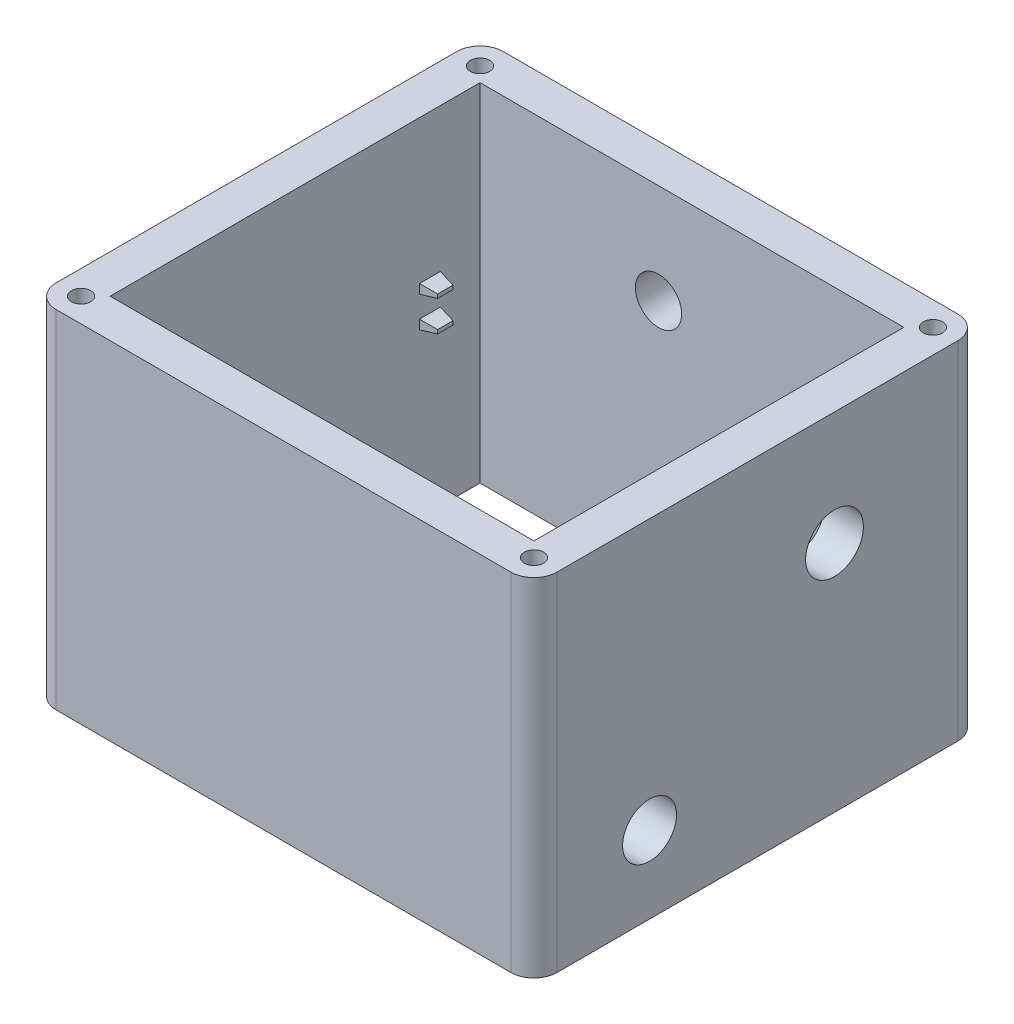
from build123d import *

# Parameters (mm, degrees)
BASE_SKETCH_W                   = 65
BASE_SKETCH_H                   = 58
BASE_SKETCH_W_2                 = 55
BASE_SKETCH_H_2                 = 48
WALLS_DEPTH                     = 45
CLIPS_START                     = 25
SKETCH_8_W                      = 2
SKETCH_8_H                      = 3
SKETCH_8_W_2                    = 3
SKETCH_8_H_2                    = 2
CLIPS_TOP_DEPTH                 = 1.5
CLIPS_START_2                   = 21
SKETCH_10_W                     = 2
SKETCH_10_H                     = 3
SKETCH_10_W_2                   = 3
SKETCH_10_H_2                   = 2
CLIPS_BOTTOM_DEPTH              = 1.5
CHAMFER5_SIZE                   = 2.83564091
CHAMFER5_SIZE_2                 = 0.5
CHAMFER6_SIZE                   = 2.83564091
CHAMFER6_SIZE_2                 = 0.5
CHAMFER4_SIZE                   = 2.83564091
CHAMFER4_SIZE_2                 = 0.5
CHAMFER7_SIZE                   = 2.83564091
CHAMFER7_SIZE_2                 = 0.5
CHAMFER8_SIZE                   = 2.83564091
CHAMFER8_SIZE_2                 = 0.5
CHAMFER9_SIZE                   = 2.83564091
CHAMFER9_SIZE_2                 = 0.5
RIGHT_START                     = 70
JACK_ENCODER_R                  = 3.5
JACK_ENCODER_R_2                = 3.75
RIGHT_HOLES_DEPTH               = 23
FILLET1_R                       = 3
HOLES_R                         = 1.25
MOUNTING_HOLES_DEPTH            = 99.051007134
ON_OFF_START                    = -50
ON_OFF_SWITCH_R                 = 3
ON_OFF_TOGGLE_SWITCH_HOLE_DEPTH = 13
BOSS_EXTRUDE7_START             = -58
ON_OFF_SWITCH_7_R               = 0.8
BOSS_EXTRUDE7_DEPTH             = 0.9


with BuildPart() as part:
    # Base Sketch → Walls (new body)
    with BuildSketch(Plane(origin=(0, 0, 0), x_dir=(1, 0, 0), z_dir=(0, 1, 0))):
        with Locations((32.5, 29)):
            Rectangle(BASE_SKETCH_W, BASE_SKETCH_H)
        with Locations((32.5, 29)):
            Rectangle(BASE_SKETCH_W_2, BASE_SKETCH_H_2, mode=Mode.SUBTRACT)
    extrude(amount=WALLS_DEPTH)

    # Sketch<8> → Clips Top (add)
    with BuildSketch(Plane(origin=(0, 0, 0), x_dir=(1, 0, 0), z_dir=(0, 1, 0)).offset(CLIPS_START)):
        with Locations((6, 46.5)):
            Rectangle(SKETCH_8_W, SKETCH_8_H)
        with Locations((59, 31.5)):
            Rectangle(SKETCH_8_W, SKETCH_8_H)
        with Locations((45.5, 6)):
            Rectangle(SKETCH_8_W_2, SKETCH_8_H_2)
    extrude(amount=CLIPS_TOP_DEPTH)

    # Sketch<10> → Clips Bottom (add)
    with BuildSketch(Plane(origin=(0, 0, 0), x_dir=(1, 0, 0), z_dir=(0, 1, 0)).offset(CLIPS_START_2)):
        with Locations((6, 46.5)):
            Rectangle(SKETCH_10_W, SKETCH_10_H)
        with Locations((59, 31.5)):
            Rectangle(SKETCH_10_W, SKETCH_10_H)
        with Locations((45.5, 6)):
            Rectangle(SKETCH_10_W_2, SKETCH_10_H_2)
    extrude(amount=CLIPS_BOTTOM_DEPTH)

    # Chamfer5
    # the kernel refuses this chamfer: 2.83564091, 0.5 mm, written as the material it takes off along each edge
    with BuildSketch(Plane(origin=(58, 17.631477083, -33), x_dir=(0.9999776716360547, 0, -0.006682531656102045), z_dir=(0, 1, 0))) as chamfer5_piece_1_section:
        Polygon((CHAMFER5_SIZE * 0.999977671569, -CHAMFER5_SIZE * 0.00668253165565), (-CHAMFER5_SIZE_2 * 0.0066825316561, -CHAMFER5_SIZE_2 * 0.999977671636), (0, 0), align=None)
    chamfer5_piece_1 = extrude(amount=16.237045834, mode=Mode.PRIVATE)
    chamfer5_piece_1 = split(chamfer5_piece_1, bisect_by=Plane(origin=(60, 25.75, -32.822153916), z_dir=(-1, 0, 0)), keep=Keep.TOP, mode=Mode.PRIVATE)
    chamfer5_piece_1 = split(chamfer5_piece_1, bisect_by=Plane(origin=(58.818410381, 22.5, -32.822153916), z_dir=(0, 1, 0)), keep=Keep.TOP, mode=Mode.PRIVATE)
    add(chamfer5_piece_1, mode=Mode.SUBTRACT)
    with BuildSketch(Plane(origin=(58, 26.5, -40.368522917), x_dir=(0.9999776716360547, 0.006682531656102045, -2.368422901677664e-15), z_dir=(0, 0, 1))) as chamfer5_piece_2_section:
        Polygon((CHAMFER5_SIZE * 0.999977671569, -CHAMFER5_SIZE * 0.00668253165565), (-CHAMFER5_SIZE_2 * 0.0066825316561, -CHAMFER5_SIZE_2 * 0.999977671636), (0, 0), align=None)
    chamfer5_piece_2 = extrude(amount=17.737045834, mode=Mode.PRIVATE)
    chamfer5_piece_2 = split(chamfer5_piece_2, bisect_by=Plane(origin=(60, 26.322153916, -31.5), z_dir=(-1, 0, 0)), keep=Keep.TOP, mode=Mode.PRIVATE)
    add(chamfer5_piece_2, mode=Mode.SUBTRACT)
    with BuildSketch(Plane(origin=(58, 17.631477083, -30), x_dir=(0.9999776716360547, 0, 0.006682531656103251), z_dir=(0, 1, 0))) as chamfer5_piece_3_section:
        Polygon((CHAMFER5_SIZE * 0.999977671569, CHAMFER5_SIZE * 0.00668253165565), (-CHAMFER5_SIZE_2 * 0.0066825316561, CHAMFER5_SIZE_2 * 0.999977671636), (0, 0), align=None)
    chamfer5_piece_3 = extrude(amount=16.237045834, mode=Mode.PRIVATE)
    chamfer5_piece_3 = split(chamfer5_piece_3, bisect_by=Plane(origin=(60, 25.75, -30.177846084), z_dir=(-1, 0, 0)), keep=Keep.TOP, mode=Mode.PRIVATE)
    chamfer5_piece_3 = split(chamfer5_piece_3, bisect_by=Plane(origin=(58.818410381, 22.5, -30.177846084), z_dir=(0, 1, 0)), keep=Keep.TOP, mode=Mode.PRIVATE)
    add(chamfer5_piece_3, mode=Mode.SUBTRACT)
    with BuildSketch(Plane(origin=(58, 25, -40.368522917), x_dir=(0.9999776716360547, -0.006682531656102045, -2.368422901677664e-15), z_dir=(0, 0, 1))) as chamfer5_piece_4_section:
        Polygon((CHAMFER5_SIZE * 0.999977671569, CHAMFER5_SIZE * 0.00668253165565), (-CHAMFER5_SIZE_2 * 0.0066825316561, CHAMFER5_SIZE_2 * 0.999977671636), (0, 0), align=None)
    chamfer5_piece_4 = extrude(amount=17.737045834, mode=Mode.PRIVATE)
    chamfer5_piece_4 = split(chamfer5_piece_4, bisect_by=Plane(origin=(60, 25.177846084, -31.5), z_dir=(-1, 0, 0)), keep=Keep.TOP, mode=Mode.PRIVATE)
    add(chamfer5_piece_4, mode=Mode.SUBTRACT)

    # Chamfer6
    # the kernel refuses this chamfer: 2.83564091, 0.5 mm, written as the material it takes off along each edge
    with BuildSketch(Plane(origin=(47, 17.631477083, -7), x_dir=(0.0066825316561019464, 0, 0.9999776716360547), z_dir=(0, 1, 0))) as chamfer6_piece_1_section:
        Polygon((CHAMFER6_SIZE * 0.999977671569, -CHAMFER6_SIZE * 0.00668253165565), (-CHAMFER6_SIZE_2 * 0.0066825316561, -CHAMFER6_SIZE_2 * 0.999977671636), (0, 0), align=None)
    chamfer6_piece_1 = extrude(amount=16.237045834, mode=Mode.PRIVATE)
    chamfer6_piece_1 = split(chamfer6_piece_1, bisect_by=Plane(origin=(46.822153916, 25.75, -5), z_dir=(0, 0, -1)), keep=Keep.TOP, mode=Mode.PRIVATE)
    chamfer6_piece_1 = split(chamfer6_piece_1, bisect_by=Plane(origin=(46.822153916, 22.5, -6.181589619), z_dir=(0, 1, 0)), keep=Keep.TOP, mode=Mode.PRIVATE)
    add(chamfer6_piece_1, mode=Mode.SUBTRACT)
    with BuildSketch(Plane(origin=(54.368522917, 26.5, -7), x_dir=(0, 0.0066825316561019464, 0.9999776716360547), z_dir=(-1, 0, 0))) as chamfer6_piece_2_section:
        Polygon((CHAMFER6_SIZE * 0.999977671569, -CHAMFER6_SIZE * 0.00668253165565), (-CHAMFER6_SIZE_2 * 0.0066825316561, -CHAMFER6_SIZE_2 * 0.999977671636), (0, 0), align=None)
    chamfer6_piece_2 = extrude(amount=17.737045834, mode=Mode.PRIVATE)
    chamfer6_piece_2 = split(chamfer6_piece_2, bisect_by=Plane(origin=(45.5, 26.322153916, -5), z_dir=(0, 0, -1)), keep=Keep.TOP, mode=Mode.PRIVATE)
    add(chamfer6_piece_2, mode=Mode.SUBTRACT)
    with BuildSketch(Plane(origin=(44, 17.631477083, -7), x_dir=(-0.0066825316561019464, 0, 0.9999776716360547), z_dir=(0, 1, 0))) as chamfer6_piece_3_section:
        Polygon((CHAMFER6_SIZE * 0.999977671569, CHAMFER6_SIZE * 0.00668253165565), (-CHAMFER6_SIZE_2 * 0.0066825316561, CHAMFER6_SIZE_2 * 0.999977671636), (0, 0), align=None)
    chamfer6_piece_3 = extrude(amount=16.237045834, mode=Mode.PRIVATE)
    chamfer6_piece_3 = split(chamfer6_piece_3, bisect_by=Plane(origin=(44.177846084, 25.75, -5), z_dir=(0, 0, -1)), keep=Keep.TOP, mode=Mode.PRIVATE)
    chamfer6_piece_3 = split(chamfer6_piece_3, bisect_by=Plane(origin=(44.177846084, 22.5, -6.181589619), z_dir=(0, 1, 0)), keep=Keep.TOP, mode=Mode.PRIVATE)
    add(chamfer6_piece_3, mode=Mode.SUBTRACT)
    with BuildSketch(Plane(origin=(54.368522917, 25, -7), x_dir=(0, -0.0066825316561019464, 0.9999776716360547), z_dir=(-1, 0, 0))) as chamfer6_piece_4_section:
        Polygon((CHAMFER6_SIZE * 0.999977671569, CHAMFER6_SIZE * 0.00668253165565), (-CHAMFER6_SIZE_2 * 0.0066825316561, CHAMFER6_SIZE_2 * 0.999977671636), (0, 0), align=None)
    chamfer6_piece_4 = extrude(amount=17.737045834, mode=Mode.PRIVATE)
    chamfer6_piece_4 = split(chamfer6_piece_4, bisect_by=Plane(origin=(45.5, 25.177846084, -5), z_dir=(0, 0, -1)), keep=Keep.TOP, mode=Mode.PRIVATE)
    add(chamfer6_piece_4, mode=Mode.SUBTRACT)

    # Chamfer4
    # the kernel refuses this chamfer: 2.83564091, 0.5 mm, written as the material it takes off along each edge
    with BuildSketch(Plane(origin=(7, 17.631477083, -45), x_dir=(-0.9999776716360547, 0, 0.006682531656101981), z_dir=(0, 1, 0))) as chamfer4_piece_1_section:
        Polygon((CHAMFER4_SIZE * 0.999977671569, -CHAMFER4_SIZE * 0.00668253165565), (-CHAMFER4_SIZE_2 * 0.0066825316561, -CHAMFER4_SIZE_2 * 0.999977671636), (0, 0), align=None)
    chamfer4_piece_1 = extrude(amount=16.237045834, mode=Mode.PRIVATE)
    chamfer4_piece_1 = split(chamfer4_piece_1, bisect_by=Plane(origin=(5, 25.75, -45.177846084), z_dir=(1, 0, 0)), keep=Keep.TOP, mode=Mode.PRIVATE)
    chamfer4_piece_1 = split(chamfer4_piece_1, bisect_by=Plane(origin=(6.181589619, 22.5, -45.177846084), z_dir=(0, 1, 0)), keep=Keep.TOP, mode=Mode.PRIVATE)
    add(chamfer4_piece_1, mode=Mode.SUBTRACT)
    with BuildSketch(Plane(origin=(7, 26.5, -37.631477083), x_dir=(-0.9999776716360547, 0.006682531656101981, 0), z_dir=(0, 0, -1))) as chamfer4_piece_2_section:
        Polygon((CHAMFER4_SIZE * 0.999977671569, -CHAMFER4_SIZE * 0.00668253165565), (-CHAMFER4_SIZE_2 * 0.0066825316561, -CHAMFER4_SIZE_2 * 0.999977671636), (0, 0), align=None)
    chamfer4_piece_2 = extrude(amount=10.368522917, mode=Mode.PRIVATE)
    chamfer4_piece_2 = split(chamfer4_piece_2, bisect_by=Plane(origin=(5, 26.322153916, -46.5), z_dir=(1, 0, 0)), keep=Keep.TOP, mode=Mode.PRIVATE)
    add(chamfer4_piece_2, mode=Mode.SUBTRACT)
    with BuildSketch(Plane(origin=(7, 17.631477083, -48), x_dir=(-0.9999776716360547, 0, -0.006682531656101981), z_dir=(0, 1, 0))) as chamfer4_piece_3_section:
        Polygon((CHAMFER4_SIZE * 0.999977671569, CHAMFER4_SIZE * 0.00668253165565), (-CHAMFER4_SIZE_2 * 0.0066825316561, CHAMFER4_SIZE_2 * 0.999977671636), (0, 0), align=None)
    chamfer4_piece_3 = extrude(amount=16.237045834, mode=Mode.PRIVATE)
    chamfer4_piece_3 = split(chamfer4_piece_3, bisect_by=Plane(origin=(5, 25.75, -47.822153916), z_dir=(1, 0, 0)), keep=Keep.TOP, mode=Mode.PRIVATE)
    chamfer4_piece_3 = split(chamfer4_piece_3, bisect_by=Plane(origin=(6.181589619, 22.5, -47.822153916), z_dir=(0, 1, 0)), keep=Keep.TOP, mode=Mode.PRIVATE)
    add(chamfer4_piece_3, mode=Mode.SUBTRACT)
    with BuildSketch(Plane(origin=(7, 25, -37.631477083), x_dir=(-0.9999776716360547, -0.006682531656101981, 0), z_dir=(0, 0, -1))) as chamfer4_piece_4_section:
        Polygon((CHAMFER4_SIZE * 0.999977671569, CHAMFER4_SIZE * 0.00668253165565), (-CHAMFER4_SIZE_2 * 0.0066825316561, CHAMFER4_SIZE_2 * 0.999977671636), (0, 0), align=None)
    chamfer4_piece_4 = extrude(amount=10.368522917, mode=Mode.PRIVATE)
    chamfer4_piece_4 = split(chamfer4_piece_4, bisect_by=Plane(origin=(5, 25.177846084, -46.5), z_dir=(1, 0, 0)), keep=Keep.TOP, mode=Mode.PRIVATE)
    add(chamfer4_piece_4, mode=Mode.SUBTRACT)

    # Chamfer7
    # the kernel refuses this chamfer: 2.83564091, 0.5 mm, written as the material it takes off along each edge
    with BuildSketch(Plane(origin=(7, 13.631477083, -45), x_dir=(-0.9999776716360547, 0, 0.006682531656101981), z_dir=(0, 1, 0))) as chamfer7_piece_1_section:
        Polygon((CHAMFER7_SIZE * 0.999977671569, -CHAMFER7_SIZE * 0.00668253165565), (-CHAMFER7_SIZE_2 * 0.0066825316561, -CHAMFER7_SIZE_2 * 0.999977671636), (0, 0), align=None)
    chamfer7_piece_1 = extrude(amount=16.237045834, mode=Mode.PRIVATE)
    chamfer7_piece_1 = split(chamfer7_piece_1, bisect_by=Plane(origin=(5, 21.75, -45.177846084), z_dir=(1, 0, 0)), keep=Keep.TOP, mode=Mode.PRIVATE)
    add(chamfer7_piece_1, mode=Mode.SUBTRACT)
    with BuildSketch(Plane(origin=(7, 22.5, -37.631477083), x_dir=(-0.9999776716360547, 0.006682531656101981, 0), z_dir=(0, 0, -1))) as chamfer7_piece_2_section:
        Polygon((CHAMFER7_SIZE * 0.999977671569, -CHAMFER7_SIZE * 0.00668253165565), (-CHAMFER7_SIZE_2 * 0.0066825316561, -CHAMFER7_SIZE_2 * 0.999977671636), (0, 0), align=None)
    chamfer7_piece_2 = extrude(amount=10.368522917, mode=Mode.PRIVATE)
    chamfer7_piece_2 = split(chamfer7_piece_2, bisect_by=Plane(origin=(5, 22.322153916, -46.5), z_dir=(1, 0, 0)), keep=Keep.TOP, mode=Mode.PRIVATE)
    add(chamfer7_piece_2, mode=Mode.SUBTRACT)
    with BuildSketch(Plane(origin=(7, 13.631477083, -48), x_dir=(-0.9999776716360547, 0, -0.006682531656101981), z_dir=(0, 1, 0))) as chamfer7_piece_3_section:
        Polygon((CHAMFER7_SIZE * 0.999977671569, CHAMFER7_SIZE * 0.00668253165565), (-CHAMFER7_SIZE_2 * 0.0066825316561, CHAMFER7_SIZE_2 * 0.999977671636), (0, 0), align=None)
    chamfer7_piece_3 = extrude(amount=16.237045834, mode=Mode.PRIVATE)
    chamfer7_piece_3 = split(chamfer7_piece_3, bisect_by=Plane(origin=(5, 21.75, -47.822153916), z_dir=(1, 0, 0)), keep=Keep.TOP, mode=Mode.PRIVATE)
    add(chamfer7_piece_3, mode=Mode.SUBTRACT)
    with BuildSketch(Plane(origin=(7, 21, -37.631477083), x_dir=(-0.9999776716360547, -0.006682531656101981, 0), z_dir=(0, 0, -1))) as chamfer7_piece_4_section:
        Polygon((CHAMFER7_SIZE * 0.999977671569, CHAMFER7_SIZE * 0.00668253165565), (-CHAMFER7_SIZE_2 * 0.0066825316561, CHAMFER7_SIZE_2 * 0.999977671636), (0, 0), align=None)
    chamfer7_piece_4 = extrude(amount=10.368522917, mode=Mode.PRIVATE)
    chamfer7_piece_4 = split(chamfer7_piece_4, bisect_by=Plane(origin=(5, 21.177846084, -46.5), z_dir=(1, 0, 0)), keep=Keep.TOP, mode=Mode.PRIVATE)
    add(chamfer7_piece_4, mode=Mode.SUBTRACT)

    # Chamfer8
    # the kernel refuses this chamfer: 2.83564091, 0.5 mm, written as the material it takes off along each edge
    with BuildSketch(Plane(origin=(58, 13.631477083, -33), x_dir=(0.9999776716360547, 0, -0.006682531656102045), z_dir=(0, 1, 0))) as chamfer8_piece_1_section:
        Polygon((CHAMFER8_SIZE * 0.999977671569, -CHAMFER8_SIZE * 0.00668253165565), (-CHAMFER8_SIZE_2 * 0.0066825316561, -CHAMFER8_SIZE_2 * 0.999977671636), (0, 0), align=None)
    chamfer8_piece_1 = extrude(amount=16.237045834, mode=Mode.PRIVATE)
    chamfer8_piece_1 = split(chamfer8_piece_1, bisect_by=Plane(origin=(60, 21.75, -32.844885748), z_dir=(-1, 0, 0)), keep=Keep.TOP, mode=Mode.PRIVATE)
    add(chamfer8_piece_1, mode=Mode.SUBTRACT)
    with BuildSketch(Plane(origin=(58, 22.5, -40.368522917), x_dir=(0.9999776716360547, 0.006682531656102045, 0), z_dir=(0, 0, 1))) as chamfer8_piece_2_section:
        Polygon((CHAMFER8_SIZE * 0.999977671569, -CHAMFER8_SIZE * 0.00668253165565), (-CHAMFER8_SIZE_2 * 0.0066825316561, -CHAMFER8_SIZE_2 * 0.999977671636), (0, 0), align=None)
    chamfer8_piece_2 = extrude(amount=17.737045834, mode=Mode.PRIVATE)
    chamfer8_piece_2 = split(chamfer8_piece_2, bisect_by=Plane(origin=(60, 22.344885748, -31.5), z_dir=(-1, 0, 0)), keep=Keep.TOP, mode=Mode.PRIVATE)
    add(chamfer8_piece_2, mode=Mode.SUBTRACT)
    with BuildSketch(Plane(origin=(58, 13.631477083, -30), x_dir=(0.9999776716360547, 0, 0.006682531656103251), z_dir=(0, 1, 0))) as chamfer8_piece_3_section:
        Polygon((CHAMFER8_SIZE * 0.999977671569, CHAMFER8_SIZE * 0.00668253165565), (-CHAMFER8_SIZE_2 * 0.0066825316561, CHAMFER8_SIZE_2 * 0.999977671636), (0, 0), align=None)
    chamfer8_piece_3 = extrude(amount=16.237045834, mode=Mode.PRIVATE)
    chamfer8_piece_3 = split(chamfer8_piece_3, bisect_by=Plane(origin=(60, 21.75, -30.155114252), z_dir=(-1, 0, 0)), keep=Keep.TOP, mode=Mode.PRIVATE)
    add(chamfer8_piece_3, mode=Mode.SUBTRACT)
    with BuildSketch(Plane(origin=(58, 21, -40.368522917), x_dir=(0.9999776716360547, -0.006682531656102045, -2.368422901677664e-15), z_dir=(0, 0, 1))) as chamfer8_piece_4_section:
        Polygon((CHAMFER8_SIZE * 0.999977671569, CHAMFER8_SIZE * 0.00668253165565), (-CHAMFER8_SIZE_2 * 0.0066825316561, CHAMFER8_SIZE_2 * 0.999977671636), (0, 0), align=None)
    chamfer8_piece_4 = extrude(amount=17.737045834, mode=Mode.PRIVATE)
    chamfer8_piece_4 = split(chamfer8_piece_4, bisect_by=Plane(origin=(60, 21.155114252, -31.5), z_dir=(-1, 0, 0)), keep=Keep.TOP, mode=Mode.PRIVATE)
    add(chamfer8_piece_4, mode=Mode.SUBTRACT)

    # Chamfer9
    # the kernel refuses this chamfer: 2.83564091, 0.5 mm, written as the material it takes off along each edge
    with BuildSketch(Plane(origin=(47, 13.631477083, -7), x_dir=(0.0066825316561019464, 0, 0.9999776716360547), z_dir=(0, 1, 0))) as chamfer9_piece_1_section:
        Polygon((CHAMFER9_SIZE * 0.999977671569, -CHAMFER9_SIZE * 0.00668253165565), (-CHAMFER9_SIZE_2 * 0.0066825316561, -CHAMFER9_SIZE_2 * 0.999977671636), (0, 0), align=None)
    chamfer9_piece_1 = extrude(amount=16.237045834, mode=Mode.PRIVATE)
    chamfer9_piece_1 = split(chamfer9_piece_1, bisect_by=Plane(origin=(46.844885748, 21.75, -5), z_dir=(0, 0, -1)), keep=Keep.TOP, mode=Mode.PRIVATE)
    add(chamfer9_piece_1, mode=Mode.SUBTRACT)
    with BuildSketch(Plane(origin=(54.368522917, 22.5, -7), x_dir=(0, 0.0066825316561019464, 0.9999776716360547), z_dir=(-1, 0, 0))) as chamfer9_piece_2_section:
        Polygon((CHAMFER9_SIZE * 0.999977671569, -CHAMFER9_SIZE * 0.00668253165565), (-CHAMFER9_SIZE_2 * 0.0066825316561, -CHAMFER9_SIZE_2 * 0.999977671636), (0, 0), align=None)
    chamfer9_piece_2 = extrude(amount=17.737045834, mode=Mode.PRIVATE)
    chamfer9_piece_2 = split(chamfer9_piece_2, bisect_by=Plane(origin=(45.5, 22.344885748, -5), z_dir=(0, 0, -1)), keep=Keep.TOP, mode=Mode.PRIVATE)
    add(chamfer9_piece_2, mode=Mode.SUBTRACT)
    with BuildSketch(Plane(origin=(44, 13.631477083, -7), x_dir=(-0.0066825316561019464, 0, 0.9999776716360547), z_dir=(0, 1, 0))) as chamfer9_piece_3_section:
        Polygon((CHAMFER9_SIZE * 0.999977671569, CHAMFER9_SIZE * 0.00668253165565), (-CHAMFER9_SIZE_2 * 0.0066825316561, CHAMFER9_SIZE_2 * 0.999977671636), (0, 0), align=None)
    chamfer9_piece_3 = extrude(amount=16.237045834, mode=Mode.PRIVATE)
    chamfer9_piece_3 = split(chamfer9_piece_3, bisect_by=Plane(origin=(44.155114252, 21.75, -5), z_dir=(0, 0, -1)), keep=Keep.TOP, mode=Mode.PRIVATE)
    add(chamfer9_piece_3, mode=Mode.SUBTRACT)
    with BuildSketch(Plane(origin=(54.368522917, 21, -7), x_dir=(0, -0.0066825316561019464, 0.9999776716360547), z_dir=(-1, 0, 0))) as chamfer9_piece_4_section:
        Polygon((CHAMFER9_SIZE * 0.999977671569, CHAMFER9_SIZE * 0.00668253165565), (-CHAMFER9_SIZE_2 * 0.0066825316561, CHAMFER9_SIZE_2 * 0.999977671636), (0, 0), align=None)
    chamfer9_piece_4 = extrude(amount=17.737045834, mode=Mode.PRIVATE)
    chamfer9_piece_4 = split(chamfer9_piece_4, bisect_by=Plane(origin=(45.5, 21.155114252, -5), z_dir=(0, 0, -1)), keep=Keep.TOP, mode=Mode.PRIVATE)
    add(chamfer9_piece_4, mode=Mode.SUBTRACT)

    # Jack & Encoder → Right Holes (cut)
    with BuildSketch(Plane(origin=(0, 0, 0), x_dir=(0, 0, -1), z_dir=(1, 0, 0)).offset(RIGHT_START)):
        with Locations((15, 10)):
            Circle(JACK_ENCODER_R)
        with Locations((39, 30.25)):
            Circle(JACK_ENCODER_R_2)
    extrude(amount=-RIGHT_HOLES_DEPTH, mode=Mode.SUBTRACT)

    # Fillet1
    fillet1_edges = [part.edges().sort_by_distance(p)[0] for p in [
        (0, 22.5, 0),
        (0, 22.5, -58),
        (65, 22.5, -58),
        (65, 22.5, 0),
    ]]
    fillet(fillet1_edges, radius=FILLET1_R)

    # Holes → Mounting Holes (cut, through all)
    with BuildSketch(Plane(origin=(0, 0, 0), x_dir=(1, 0, 0), z_dir=(0, 1, 0))):
        with Locations(Location((3.115503651, 54.884496349, 0), (0, 0, 90))):
            Circle(HOLES_R)
        with Locations(Location((61.884496349, 54.884496349, 0), (0, 0, 90))):
            Circle(HOLES_R)
        with Locations(Location((61.884496349, 3.115503651, 0), (0, 0, 90))):
            Circle(HOLES_R)
        with Locations(Location((3.115503651, 3.115503651, 0), (0, 0, 90))):
            Circle(HOLES_R)
    extrude(amount=MOUNTING_HOLES_DEPTH, mode=Mode.SUBTRACT)

    # On-off Switch → On-off toggle switch hole (cut)
    with BuildSketch(Plane.XY.offset(ON_OFF_START)):
        with Locations((28.164403996, 32.056003541)):
            Circle(ON_OFF_SWITCH_R)
    extrude(amount=-ON_OFF_TOGGLE_SWITCH_HOLE_DEPTH, mode=Mode.SUBTRACT)

    # On-off Switch<7> → Boss-Extrude7 (add)
    with BuildSketch(Plane.XY.offset(BOSS_EXTRUDE7_START)):
        with Locations((8.064403996, 30.988882574)):
            Circle(ON_OFF_SWITCH_7_R)
        with Locations((8.064403996, 33.488882574)):
            Circle(ON_OFF_SWITCH_7_R)
        with Locations((10.564403996, 28.488882574)):
            Circle(ON_OFF_SWITCH_7_R)
        with Locations((15.664403996, 30.988882574)):
            Circle(ON_OFF_SWITCH_7_R)
        with Locations((18.164403996, 28.488882574)):
            Circle(ON_OFF_SWITCH_7_R)
        with Locations((18.164403996, 33.488882574)):
            Circle(ON_OFF_SWITCH_7_R)
        with Locations((55.864403996, 33.079675966)):
            Circle(ON_OFF_SWITCH_7_R)
        with Locations((38.164403996, 33.079675966)):
            Circle(ON_OFF_SWITCH_7_R)
        with Locations((40.664403996, 33.079675966)):
            Circle(ON_OFF_SWITCH_7_R)
        with Locations((40.664403996, 30.579675966)):
            Circle(ON_OFF_SWITCH_7_R)
        with Locations((45.764403996, 33.079675966)):
            Circle(ON_OFF_SWITCH_7_R)
        with Locations((48.264403996, 33.079675966)):
            Circle(ON_OFF_SWITCH_7_R)
        with Locations((48.264403996, 30.579675966)):
            Circle(ON_OFF_SWITCH_7_R)
        with Locations((55.864403996, 28.079675966)):
            Circle(ON_OFF_SWITCH_7_R)
        with Locations((53.364403996, 30.579675966)):
            Circle(ON_OFF_SWITCH_7_R)
    extrude(amount=-BOSS_EXTRUDE7_DEPTH)


solid = part.part
